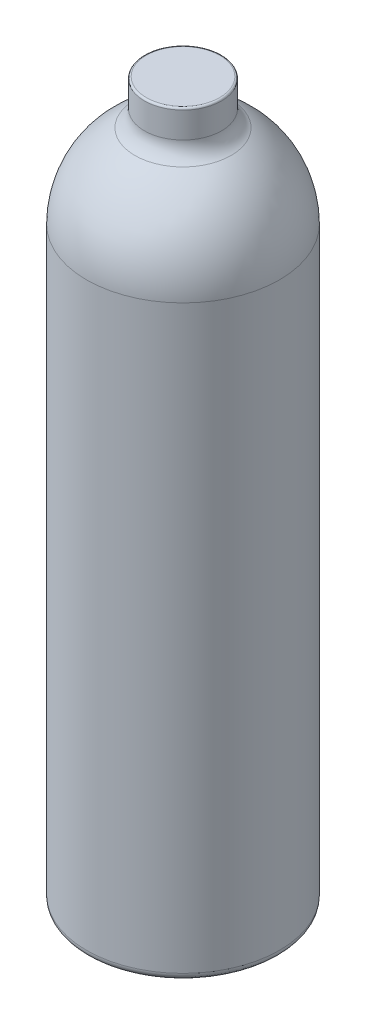
from build123d import *

# Parameters (mm, degrees)
FILLET1_R = 2.54
FILLET2_R = 0.635
FILLET3_R = 6.35


with BuildPart() as part:
    # Sketch2 → Revolve1 (revolve)
    with BuildSketch(Plane.XY, mode=Mode.PRIVATE) as revolve1_sk:
        with BuildLine():
            Line((32.0675, 0), (32.0675, 195.58))
            ThreePointArc((32.0675, 195.58), (26.829595401, 213.144093113), (12.827, 224.97034922))
            Line((12.827, 224.97034922), (12.827, 238.125))
            Line((12.827, 238.125), (0, 238.125))
            Line((0, 238.125), (0, 0.889))
            Line((0, 0.889), (23.114, 0.889))
            Line((23.114, 0.889), (23.114, 0))
            Line((23.114, 0), (32.0675, 0))
        make_face()
    revolve(revolve1_sk.sketch.rotate(Axis((0, 238.125, 0), (0, -1, 0)), 180), axis=Axis((0, 238.125, 0), (0, -1, 0)))

    # Fillet1
    # the kernel refuses this fillet: 2.54 mm, written as the material it adds along each edge
    with BuildSketch(Plane(origin=(0, 0.889, 0), x_dir=(-1, 0, 0), z_dir=(0, 0, 1))) as fillet1_piece_1:
        with BuildLine():
            CenterArc((21.183767112, 2.54), FILLET1_R, 270, 49.458398126)
            Line((23.114, 0.889), (23.114, 0))
            Line((23.114, 0), (21.183767112, 0))
        make_face()
    revolve(axis=Axis((0, 0.889, 0), (0, -1, 0)))
    # the kernel refuses this fillet: 2.54 mm, written as the material it takes off along each edge
    with BuildSketch(Plane(origin=(0, 0, 0), x_dir=(-1, 0, 0), z_dir=(0, 0, 1))) as fillet1_2_piece_1:
        with BuildLine():
            CenterArc((32.0675 - FILLET1_R, -FILLET1_R), FILLET1_R, 0, 90)
            Line((32.0675 - FILLET1_R, 0), (32.0675, 0))
            Line((32.0675, 0), (32.0675, -FILLET1_R))
        make_face()
    revolve(axis=Axis((0, 0, 0), (0, -1, 0)), mode=Mode.SUBTRACT)

    # Fillet2
    fillet2_edges = [part.edges().sort_by_distance(p)[0] for p in [
        (12.827, 238.125, 0),
    ]]
    fillet(fillet2_edges, radius=FILLET2_R)

    # Fillet3
    fillet3_edges = [part.edges().sort_by_distance(p)[0] for p in [
        (12.827, 224.97034922, 0),
    ]]
    fillet(fillet3_edges, radius=FILLET3_R)


solid = part.part
